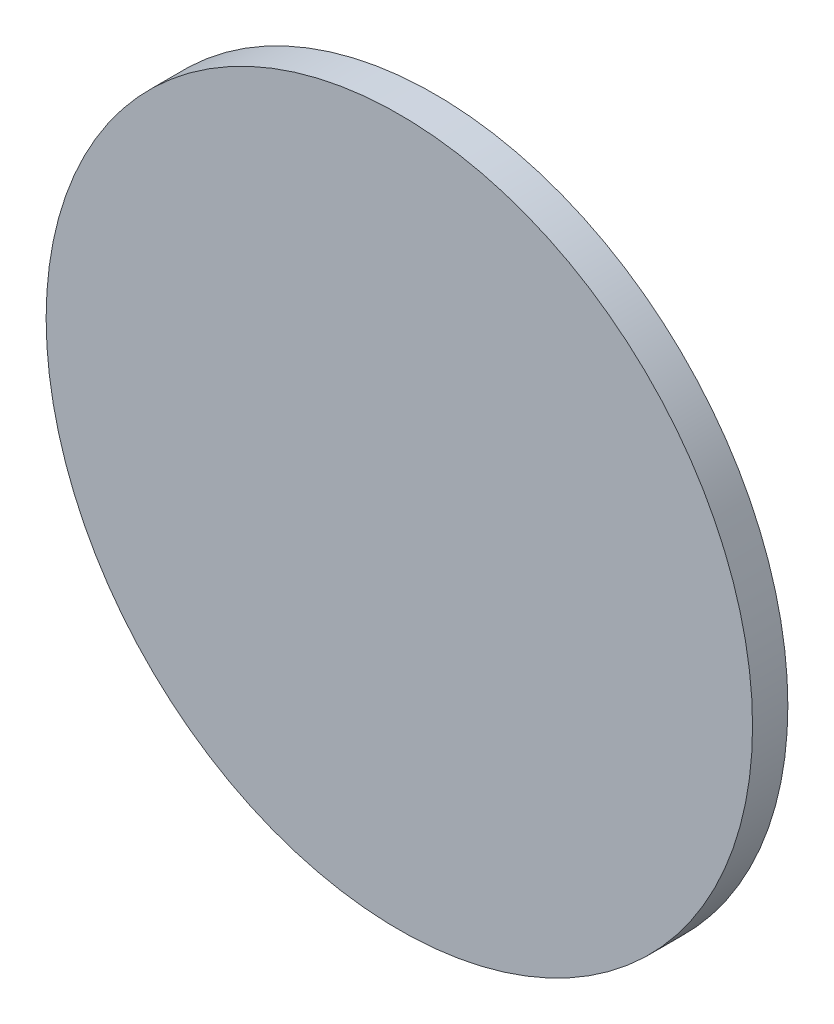
from build123d import *

# Parameters (mm, degrees)
SKETCH1_R                 = 50
BOSS_EXTRUDE1_DEPTH       = 5
SKETCH2_W                 = 34
SKETCH2_H                 = 70
BOSS_EXTRUDE3_DEPTH       = 8
SKETCH3_W                 = 27
SKETCH3_H                 = 63
CUT_EXTRUDE1_DEPTH        = 8
SKETCH4_W                 = 4
SKETCH4_H                 = 4
CUT_EXTRUDE2_DEPTH        = 99.939375377
LPATTERN1_COUNT           = 3
LPATTERN1_PITCH           = 10
SKETCH5_W                 = 4
SKETCH5_H                 = 4
CUT_EXTRUDE3_DEPTH        = 84.982140959
LPATTERN2_COUNT           = 8
LPATTERN2_PITCH           = 8
SKETCH6_W                 = 27
SKETCH6_H                 = 63
BOSS_EXTRUDE4_DEPTH       = 8
SKETCH7_W                 = 25.6
SKETCH7_H                 = 60.3
CUT_EXTRUDE4_DEPTH        = 8
SKETCH8_W                 = 4
SKETCH8_H                 = 4
CUT_EXTRUDE5_DEPTH        = 84.982140959
LPATTERN4_COPY_1_SKETCH_W = 4
LPATTERN4_COPY_1_SKETCH_H = 4
LPATTERN4_COPY_1_DEPTH    = 84.982140959
LPATTERN4_COPY_2_SKETCH_W = 4
LPATTERN4_COPY_2_SKETCH_H = 4
LPATTERN4_COPY_2_DEPTH    = 84.982140959
LPATTERN4_COPY_3_SKETCH_W = 4
LPATTERN4_COPY_3_SKETCH_H = 4
LPATTERN4_COPY_3_DEPTH    = 84.982140959
LPATTERN4_COPY_4_SKETCH_W = 4
LPATTERN4_COPY_4_SKETCH_H = 4
LPATTERN4_COPY_4_DEPTH    = 84.982140959
LPATTERN4_COPY_5_SKETCH_W = 4
LPATTERN4_COPY_5_SKETCH_H = 4
LPATTERN4_COPY_5_DEPTH    = 84.982140959
LPATTERN4_COPY_6_SKETCH_W = 4
LPATTERN4_COPY_6_SKETCH_H = 4
LPATTERN4_COPY_6_DEPTH    = 84.982140959
LPATTERN4_COPY_7_SKETCH_W = 4
LPATTERN4_COPY_7_SKETCH_H = 4
LPATTERN4_COPY_7_DEPTH    = 84.982140959
LPATTERN4_COPY_8_SKETCH_W = 4
LPATTERN4_COPY_8_SKETCH_H = 4
LPATTERN4_COPY_8_DEPTH    = 84.982140959
SKETCH9_W                 = 4
SKETCH9_H                 = 4
CUT_EXTRUDE6_DEPTH        = 99.939375377
LPATTERN5_COUNT           = 2
LPATTERN5_PITCH           = 0.1
LPATTERN5_COPY_1_SKETCH_W = 4
LPATTERN5_COPY_1_SKETCH_H = 4
LPATTERN5_COPY_1_DEPTH    = 99.939375377
LPATTERN5_COPY_2_SKETCH_W = 4
LPATTERN5_COPY_2_SKETCH_H = 4
LPATTERN5_COPY_2_DEPTH    = 99.939375377
LPATTERN5_COPY_3_SKETCH_W = 4
LPATTERN5_COPY_3_SKETCH_H = 4
LPATTERN5_COPY_3_DEPTH    = 99.939375377


with BuildPart() as part:
    # Sketch1 → Boss-Extrude1 (new body)
    with BuildSketch(Plane.XY):
        Circle(SKETCH1_R)
    extrude(amount=BOSS_EXTRUDE1_DEPTH)

    # Sketch2 → Boss-Extrude3 (add)
    with BuildSketch(Plane(origin=(0, 0, 0), x_dir=(-1, 0, 0), z_dir=(0, 0, -1))):
        Rectangle(SKETCH2_W, SKETCH2_H)
    extrude(amount=BOSS_EXTRUDE3_DEPTH)

    # Sketch3 → Cut-Extrude1 (cut)
    with BuildSketch(Plane(origin=(0, 0, -8), x_dir=(-1, 0, 0), z_dir=(0, 0, -1))):
        Rectangle(SKETCH3_W, SKETCH3_H)
    extrude(amount=-CUT_EXTRUDE1_DEPTH, mode=Mode.SUBTRACT)

    # Sketch4 → Cut-Extrude2 (cut, through all)
    with BuildSketch(Plane.XZ.offset(35)):
        with Locations((-10, -4)):
            Rectangle(SKETCH4_W, SKETCH4_H)
    cut_extrude2 = extrude(amount=-CUT_EXTRUDE2_DEPTH, mode=Mode.SUBTRACT)

    # LPattern1: Cut-Extrude2 ×3
    with Locations(*[(i * LPATTERN1_PITCH, 0, 0) for i in range(1, LPATTERN1_COUNT)]):
        add(cut_extrude2, mode=Mode.SUBTRACT)

    # Sketch5 → Cut-Extrude3 (cut, through all)
    with BuildSketch(Plane.ZY.offset(17)):
        with Locations((-4, 28)):
            Rectangle(SKETCH5_W, SKETCH5_H)
    cut_extrude3 = extrude(amount=-CUT_EXTRUDE3_DEPTH, mode=Mode.SUBTRACT)

    # LPattern2: Cut-Extrude3 ×8
    with Locations(*[(0, -i * LPATTERN2_PITCH, 0) for i in range(1, LPATTERN2_COUNT)]):
        add(cut_extrude3, mode=Mode.SUBTRACT)

    # Sketch6 → Boss-Extrude4 (add)
    with BuildSketch(Plane(origin=(0, 0, -8), x_dir=(-1, 0, 0), z_dir=(0, 0, -1))):
        Rectangle(SKETCH6_W, SKETCH6_H)
    extrude(amount=-BOSS_EXTRUDE4_DEPTH)

    # Sketch7 → Cut-Extrude4 (cut)
    with BuildSketch(Plane(origin=(0, 0, -8), x_dir=(-1, 0, 0), z_dir=(0, 0, -1))):
        Rectangle(SKETCH7_W, SKETCH7_H)
    extrude(amount=-CUT_EXTRUDE4_DEPTH, mode=Mode.SUBTRACT)

    # Sketch8 → Cut-Extrude5 (cut, through all)
    with BuildSketch(Plane.ZY.offset(17)):
        with Locations((-4, -28)):
            Rectangle(SKETCH8_W, SKETCH8_H)
    extrude(amount=-CUT_EXTRUDE5_DEPTH, mode=Mode.SUBTRACT)

    # LPattern4 copy 1 sketch → LPattern4 copy 1 (cut, through all)
    with BuildSketch(Plane(origin=(-17, -7.9, 0), x_dir=(0, 0, 1), z_dir=(-1, 0, 0))):
        with Locations((-4, 28)):
            Rectangle(LPATTERN4_COPY_1_SKETCH_W, LPATTERN4_COPY_1_SKETCH_H)
    extrude(amount=-LPATTERN4_COPY_1_DEPTH, mode=Mode.SUBTRACT)

    # LPattern4 copy 2 sketch → LPattern4 copy 2 (cut, through all)
    with BuildSketch(Plane(origin=(-17, -15.9, 0), x_dir=(0, 0, 1), z_dir=(-1, 0, 0))):
        with Locations((-4, 28)):
            Rectangle(LPATTERN4_COPY_2_SKETCH_W, LPATTERN4_COPY_2_SKETCH_H)
    extrude(amount=-LPATTERN4_COPY_2_DEPTH, mode=Mode.SUBTRACT)

    # LPattern4 copy 3 sketch → LPattern4 copy 3 (cut, through all)
    with BuildSketch(Plane(origin=(-17, -23.9, 0), x_dir=(0, 0, 1), z_dir=(-1, 0, 0))):
        with Locations((-4, 28)):
            Rectangle(LPATTERN4_COPY_3_SKETCH_W, LPATTERN4_COPY_3_SKETCH_H)
    extrude(amount=-LPATTERN4_COPY_3_DEPTH, mode=Mode.SUBTRACT)

    # LPattern4 copy 4 sketch → LPattern4 copy 4 (cut, through all)
    with BuildSketch(Plane(origin=(-17, -31.9, 0), x_dir=(0, 0, 1), z_dir=(-1, 0, 0))):
        with Locations((-4, 28)):
            Rectangle(LPATTERN4_COPY_4_SKETCH_W, LPATTERN4_COPY_4_SKETCH_H)
    extrude(amount=-LPATTERN4_COPY_4_DEPTH, mode=Mode.SUBTRACT)

    # LPattern4 copy 5 sketch → LPattern4 copy 5 (cut, through all)
    with BuildSketch(Plane(origin=(-17, -39.9, 0), x_dir=(0, 0, 1), z_dir=(-1, 0, 0))):
        with Locations((-4, 28)):
            Rectangle(LPATTERN4_COPY_5_SKETCH_W, LPATTERN4_COPY_5_SKETCH_H)
    extrude(amount=-LPATTERN4_COPY_5_DEPTH, mode=Mode.SUBTRACT)

    # LPattern4 copy 6 sketch → LPattern4 copy 6 (cut, through all)
    with BuildSketch(Plane(origin=(-17, -47.9, 0), x_dir=(0, 0, 1), z_dir=(-1, 0, 0))):
        with Locations((-4, 28)):
            Rectangle(LPATTERN4_COPY_6_SKETCH_W, LPATTERN4_COPY_6_SKETCH_H)
    extrude(amount=-LPATTERN4_COPY_6_DEPTH, mode=Mode.SUBTRACT)

    # LPattern4 copy 7 sketch → LPattern4 copy 7 (cut, through all)
    with BuildSketch(Plane(origin=(-17, -55.9, 0), x_dir=(0, 0, 1), z_dir=(-1, 0, 0))):
        with Locations((-4, 28)):
            Rectangle(LPATTERN4_COPY_7_SKETCH_W, LPATTERN4_COPY_7_SKETCH_H)
    extrude(amount=-LPATTERN4_COPY_7_DEPTH, mode=Mode.SUBTRACT)

    # LPattern4 copy 8 sketch → LPattern4 copy 8 (cut, through all)
    with BuildSketch(Plane(origin=(-17, 0.1, 0), x_dir=(0, 0, 1), z_dir=(-1, 0, 0))):
        with Locations((-4, 28)):
            Rectangle(LPATTERN4_COPY_8_SKETCH_W, LPATTERN4_COPY_8_SKETCH_H)
    extrude(amount=-LPATTERN4_COPY_8_DEPTH, mode=Mode.SUBTRACT)

    # Sketch9 → Cut-Extrude6 (cut, through all)
    with BuildSketch(Plane.XZ.offset(35)):
        with Locations((10, -4)):
            Rectangle(SKETCH9_W, SKETCH9_H)
    cut_extrude6 = extrude(amount=-CUT_EXTRUDE6_DEPTH, mode=Mode.SUBTRACT)

    # LPattern5: Cut-Extrude6 ×2
    with Locations(*[(-i * LPATTERN5_PITCH, 0, 0) for i in range(1, LPATTERN5_COUNT)]):
        add(cut_extrude6, mode=Mode.SUBTRACT)

    # LPattern5 copy 1 sketch → LPattern5 copy 1 (cut, through all)
    with BuildSketch(Plane(origin=(9.9, -35, 0), x_dir=(1, 0, 0), z_dir=(0, -1, 0))):
        with Locations((-10, -4)):
            Rectangle(LPATTERN5_COPY_1_SKETCH_W, LPATTERN5_COPY_1_SKETCH_H)
    extrude(amount=-LPATTERN5_COPY_1_DEPTH, mode=Mode.SUBTRACT)

    # LPattern5 copy 2 sketch → LPattern5 copy 2 (cut, through all)
    with BuildSketch(Plane(origin=(19.9, -35, 0), x_dir=(1, 0, 0), z_dir=(0, -1, 0))):
        with Locations((-10, -4)):
            Rectangle(LPATTERN5_COPY_2_SKETCH_W, LPATTERN5_COPY_2_SKETCH_H)
    extrude(amount=-LPATTERN5_COPY_2_DEPTH, mode=Mode.SUBTRACT)

    # LPattern5 copy 3 sketch → LPattern5 copy 3 (cut, through all)
    with BuildSketch(Plane(origin=(-0.1, -35, 0), x_dir=(1, 0, 0), z_dir=(0, -1, 0))):
        with Locations((-10, -4)):
            Rectangle(LPATTERN5_COPY_3_SKETCH_W, LPATTERN5_COPY_3_SKETCH_H)
    extrude(amount=-LPATTERN5_COPY_3_DEPTH, mode=Mode.SUBTRACT)


solid = part.part
